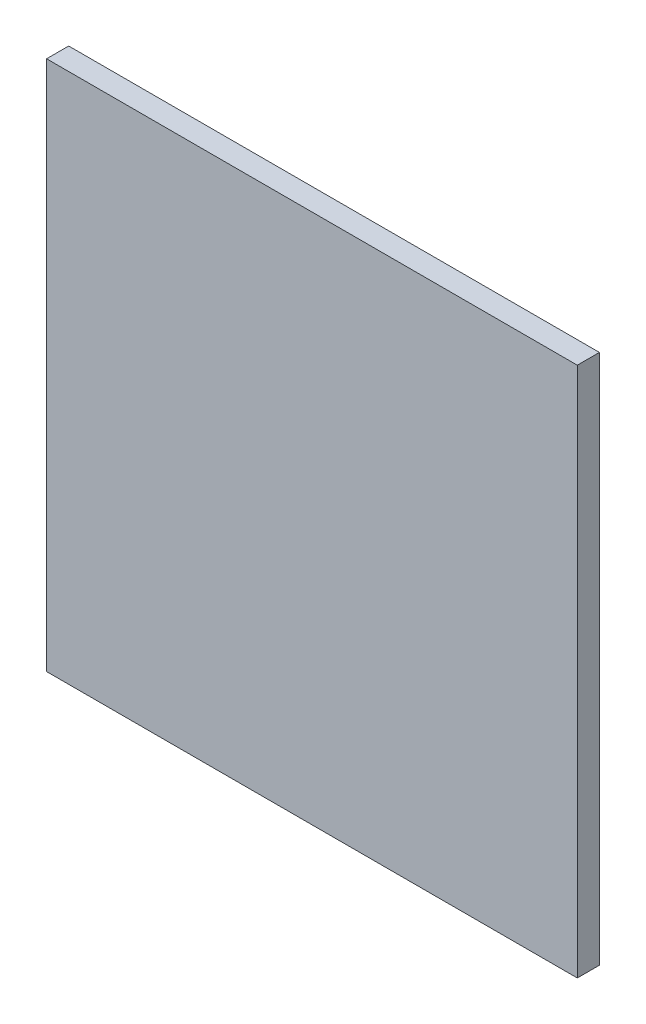
from build123d import *

# Parameters (mm, degrees)
SKETCH1_W           = 76.2
SKETCH1_H           = 76.2
BOSS_EXTRUDE1_DEPTH = 3.175


with BuildPart() as part:
    # Sketch1 → Boss-Extrude1 (new body)
    with BuildSketch(Plane.XY):
        with Locations((38.1, 38.1)):
            Rectangle(SKETCH1_W, SKETCH1_H)
    extrude(amount=BOSS_EXTRUDE1_DEPTH)


solid = part.part
